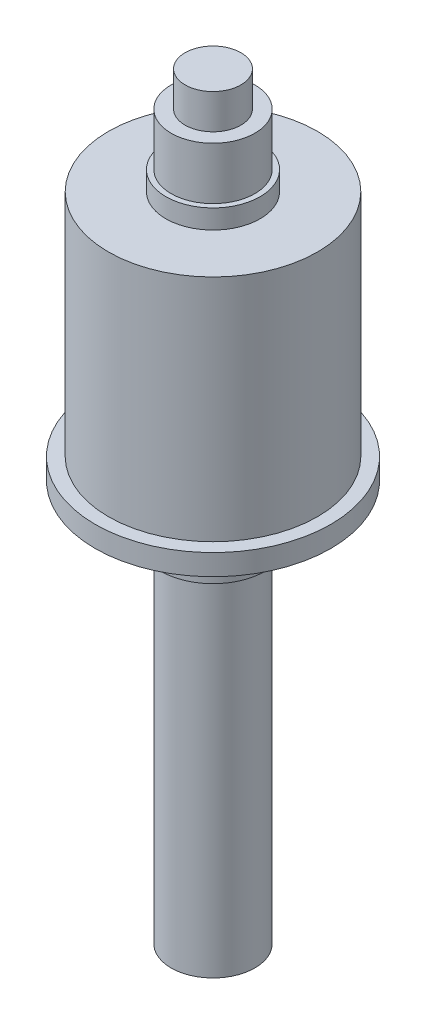
from build123d import *


with BuildPart() as part:
    # Sketch2 → Revolve1 (revolve)
    with BuildSketch(Plane.XY):
        Polygon((0, 0), (-4, 0), (-4, -5), (-6, -5), (-6, -12.5), (-6.75, -12.5), (-6.75, -15.25), (-14.9815, -15.25), (-14.9815, -48.11), (-16.8815, -48.11), (-16.8815, -51.11), (-8.25, -51.11), (-8.25, -53.61), (-7.5, -53.61), (-7.5, -58.61), (-6, -58.61), (-6, -108.61), (0, -108.61), align=None)
    revolve(axis=Axis((0, 40.033449689, 0), (0, -1, 0)))


solid = part.part
